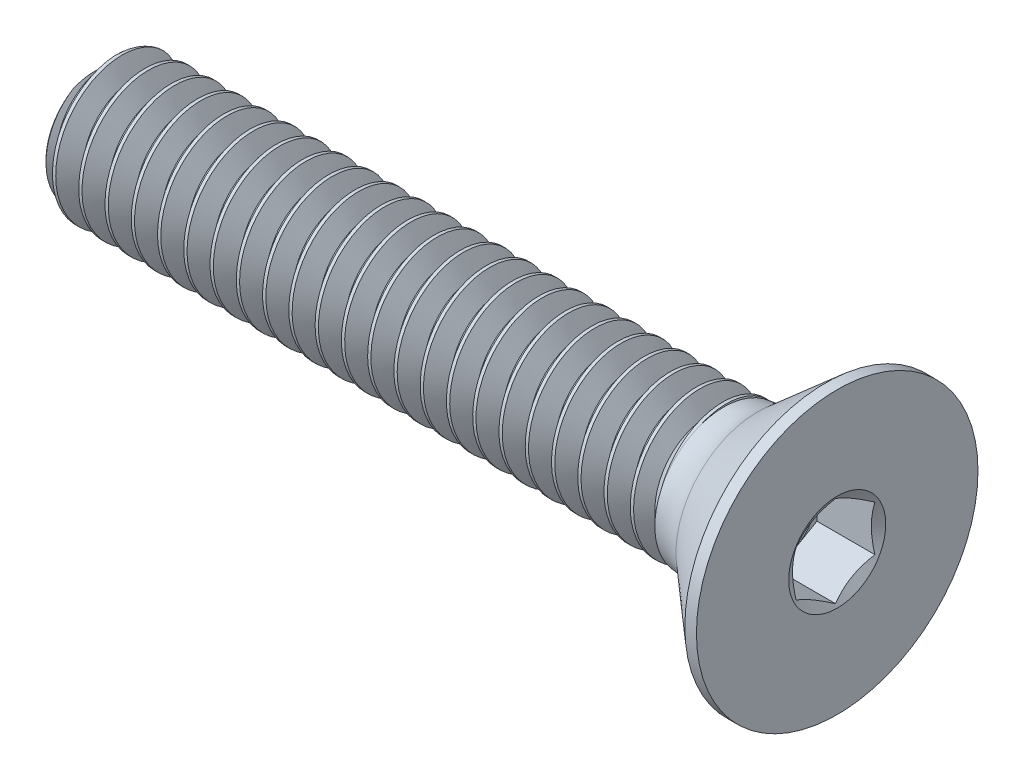
from build123d import *

# Parameters (mm, degrees)
CUT_EXTRUDE1_DEPTH = 1.8034
DELETEFACE1_START  = 8
DELETEFACE1_DEPTH  = 1.3091
CUT_SWEEP1_PITCH   = 0.79375
CUT_SWEEP1_TO      = 19.814403


with BuildPart() as part:
    # Sketch3 → Revolve1 (revolve)
    with BuildSketch(Plane.XY, mode=Mode.PRIVATE) as revolve1_sk:
        with BuildLine():
            Line((-10.715625, 2.0828), (-11.1125, 1.685925))
            Line((-11.1125, 1.685925), (-11.1125, 0))
            Line((-11.1125, 0), (11.1125, 0))
            Line((11.1125, 0), (11.1125, 4.2545))
            Line((11.1125, 4.2545), (10.761867709, 4.2545))
            Line((10.761867709, 4.2545), (8.701903003, 2.4638))
            ThreePointArc((8.701903003, 2.4638), (8.22683562, 2.181164608), (7.682872213, 2.0828))
            Line((7.682872213, 2.0828), (-10.715625, 2.0828))
        make_face()
    revolve(revolve1_sk.sketch.rotate(Axis((11.1125, 0, 0), (-1, 0, 0)), 90), axis=Axis((11.1125, 0, 0), (-1, 0, 0)))

    # Sketch4 → Cut-Extrude1 (cut)
    with BuildSketch(Plane(origin=(11.1125, 0, 0), x_dir=(0, 0, -1), z_dir=(1, 0, 0))):
        Polygon((0, 1.374815329), (-1.190625, 0.687407664), (-1.190625, -0.687407664), (0, -1.374815329), (1.190625, -0.687407664), (1.190625, 0.687407664), align=None)
    extrude(amount=-CUT_EXTRUDE1_DEPTH, mode=Mode.SUBTRACT)

    # Cut-Extrude2 cone 1 section (through the dimple's axis) → Cut-Extrude2 (revolve, cut)
    with BuildSketch(Plane(origin=(11.1125, 0, 0), x_dir=(0, 0, -1), z_dir=(0, 1, 0))):
        Polygon((0, 0), (1.466910493, 0), (0, 0.846921168), align=None)
    revolve(axis=Axis((11.1125, 0, 0), (-1, 0, 0)), mode=Mode.SUBTRACT)

    # Cut-Extrude3 cone 1 section (through the dimple's axis) → Cut-Extrude3 (revolve, cut)
    with BuildSketch(Plane(origin=(9.3091, 0, 0), x_dir=(0, 0, -1), z_dir=(0, 1, 0))):
        Polygon((0, 0), (1.190625, 0), (0, 0.687407664), align=None)
    revolve(axis=Axis((9.3091, 0, 0), (-1, 0, 0)), mode=Mode.SUBTRACT)

    # DeleteFace1: read off the stored shape, not the designer's step
    # DeleteFace1 outline → DeleteFace1 (add)
    with BuildSketch(Plane.YZ.offset(DELETEFACE1_START)):
        Polygon((-0.687407664, -1.190625), (0.687407664, -1.190625), (1.374815329, 0), (0.687407664, 1.190625), (-0.687407664, 1.190625), (-1.374815329, 0), align=None)
    extrude(amount=DELETEFACE1_DEPTH)


with BuildPart() as body_2:
    # Split1: the piece on the far side of the plane
    add(part.part)
    split(bisect_by=Plane(origin=(8.701903003, 0, 0), x_dir=(0, 0, 1), z_dir=(1, 0, 0)), keep=Keep.BOTTOM)

    # Cut-Sweep1: arcs per turn and ends read off the stored shape
    # Cut-Sweep1: the profile of Sketch7 screwed along a right-hand helix through 28 turns, 8 arcs to a turn; built about Z, then put on its axis
    cut_sweep1_z = Axis((0, 0, 0), (0, 0, 1))
    cut_sweep1_corners = [(1.567244252, 0, -0.396875), (2.125762979, 0, -0.719335938), (2.125762979, 0, 0.024804687), (1.567244252, 0, -0.29765625)]
    with BuildLine(mode=Mode.PRIVATE) as cut_sweep1_profile:
        Line(cut_sweep1_corners[0], cut_sweep1_corners[1])
        Line(cut_sweep1_corners[1], cut_sweep1_corners[2])
        Line(cut_sweep1_corners[2], cut_sweep1_corners[3])
        Line(cut_sweep1_corners[3], cut_sweep1_corners[0])
    cut_sweep1_cap = Face(cut_sweep1_profile.wire())
    cut_sweep1_turn_angles = [0, 22.5, 45, 67.5, 90, 112.5, 135, 157.5, 180, 202.5, 225, 247.5, 270, 292.5, 315, 337.5, 360]
    cut_sweep1_turn_weights = [1, 0.9238795325112867, 1, 0.9238795325112867, 1, 0.9238795325112867, 1, 0.9238795325112867, 1, 0.9238795325112867, 1, 0.9238795325112867, 1, 0.9238795325112867, 1, 0.9238795325112867, 1]
    cut_sweep1_turn_rails = [Edge.make_bspline([Vector(p[0], p[1], 0).rotate(cut_sweep1_z, cut_sweep1_turn_angles[k]) / cut_sweep1_turn_weights[k] + Vector(0, 0, p[2] + CUT_SWEEP1_PITCH * cut_sweep1_turn_angles[k] / 360) for k in range(17)], [0, 0, 0, 1, 1, 2, 2, 3, 3, 4, 4, 5, 5, 6, 6, 7, 7, 8, 8, 8], 2, cut_sweep1_turn_weights) for p in cut_sweep1_corners]
    cut_sweep1_turn_sides = [Face.make_surface_from_curves(cut_sweep1_turn_rails[p[0]], cut_sweep1_turn_rails[p[1]]) for p in [(0, 1), (1, 2), (2, 3), (3, 0)]]
    cut_sweep1 = Plane(origin=(-11.1125, 0, 0), x_dir=(0, -1, 0), z_dir=(1, 0, 0)) * split(Solid(Shell([*[p.moved(Location((0, 0, CUT_SWEEP1_PITCH * i))) for i in range(28) for p in cut_sweep1_turn_sides], cut_sweep1_cap, cut_sweep1_cap.rotate(cut_sweep1_z, 10080).moved(Location((0, 0, CUT_SWEEP1_PITCH * 10080 / 360)))])), bisect_by=Plane.XY.offset(CUT_SWEEP1_TO), keep=Keep.BOTTOM, mode=Mode.PRIVATE)
    add(cut_sweep1, mode=Mode.SUBTRACT)


with BuildPart() as part_1:
    add(part.part)

    # Split1
    split(bisect_by=Plane(origin=(8.701903003, 0, 0), x_dir=(0, 0, 1), z_dir=(1, 0, 0)), keep=Keep.TOP)

    add(body_2.part)  # Revolve2 merges body 2
    # Sketch9 → Revolve2 (revolve)
    with BuildSketch(Plane.XY, mode=Mode.PRIVATE) as revolve2_sk:
        with BuildLine():
            Line((7.682872213, 2.0828), (7.682872213, 0))
            Line((7.682872213, 0), (8.701903003, 0))
            Line((8.701903003, 0), (8.701903003, 2.4638))
            ThreePointArc((8.701903003, 2.4638), (8.22683562, 2.181164608), (7.682872213, 2.0828))
        make_face()
    revolve(revolve2_sk.sketch.rotate(Axis((7.682872213, 0, 0), (1, 0, 0)), 270), axis=Axis((7.682872213, 0, 0), (1, 0, 0)))

    # Cut-Extrude4 cone 1 section (through the dimple's axis) → Cut-Extrude4 (revolve, cut)
    with BuildSketch(Plane(origin=(9.3091, 0, 0), x_dir=(0, 0, -1), z_dir=(0, 1, 0))):
        Polygon((0, 0), (1.190625, 0), (0, 0.687407664), align=None)
    revolve(axis=Axis((9.3091, 0, 0), (-1, 0, 0)), mode=Mode.SUBTRACT)

    # Boss-Extrude1: read off the stored shape, not the designer's step
    # Boss-Extrude1 outline → Boss-Extrude1 (revolve)
    with BuildSketch(Plane.YX):
        Polygon((1.567237901, 7.682872213), (1.567237901, 7.167310114), (2.0828, 7.682872213), align=None)
    revolve(axis=Axis((0, 0, 0), (1, 0, 0)))


solid = part_1.part
